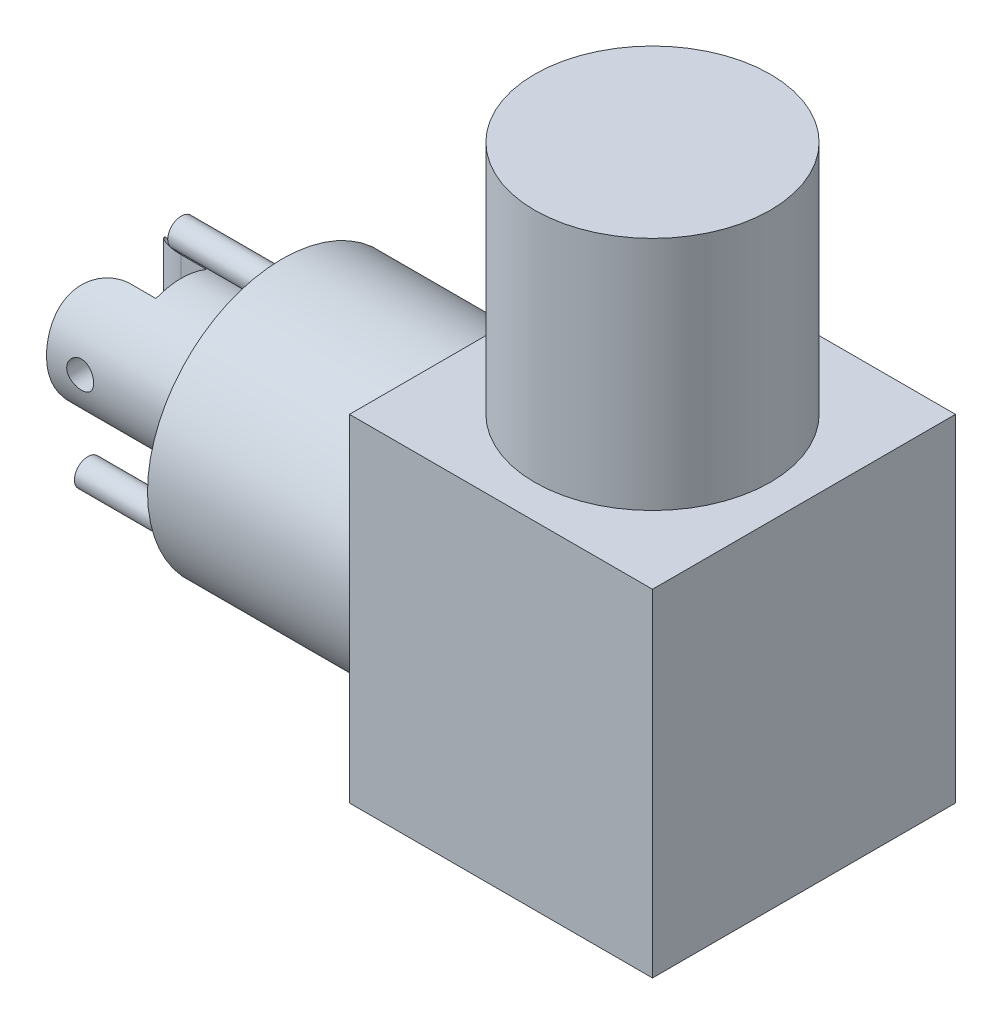
from build123d import *

# Parameters (mm, degrees)
SKETCH2_R               = 20
BOSS_EXTRUDE2_DEPTH     = 50
CUT_EXTRUDE1_DEPTH      = 20
FILLET1_R               = 12.5
CUT_EXTRUDE2_DEPTH      = 61.466933273
CUT_EXTRUDE2_DEPTH_BACK = 61.466933273
SKETCH4_R               = 4
SKETCH5_R               = 40
BOSS_EXTRUDE3_DEPTH     = 65
SKETCH7_R               = 4
BOSS_EXTRUDE5_DEPTH     = 30
CIRPATTERN1_COUNT       = 3
SKETCH8_W               = 90
SKETCH8_H               = 100
BOSS_EXTRUDE6_DEPTH     = 90
SKETCH9_R               = 35
BOSS_EXTRUDE7_DEPTH     = 70


with BuildPart() as part:
    # Sketch2 → Boss-Extrude2 (new body)
    with BuildSketch(Plane(origin=(0, 0, 0), x_dir=(0, 0, -1), z_dir=(1, 0, 0))):
        Circle(SKETCH2_R)
    extrude(amount=BOSS_EXTRUDE2_DEPTH)

    # Sketch3 → Cut-Extrude1 (cut)
    with BuildSketch(Plane.ZY):
        with BuildLine():
            Line((-7.5, 18.540496218), (-7.5, -18.540496218))
            ThreePointArc((-7.5, -18.540496218), (0, -20), (7.5, -18.540496218))
            Line((7.5, -18.540496218), (7.5, 18.540496218))
            ThreePointArc((7.5, 18.540496218), (0, 20), (-7.5, 18.540496218))
        make_face()
    extrude(amount=-CUT_EXTRUDE1_DEPTH, mode=Mode.SUBTRACT)

    # Fillet1
    fillet1_edges = [part.edges().sort_by_distance(p)[0] for p in [
        (0, 0, 7.5),
        (0, 0, -7.5),
    ]]
    fillet(fillet1_edges, radius=FILLET1_R - 0.0001)  # a hair under: the kernel refuses the full size

    # Sketch4 → Cut-Extrude2 (cut, two sides: drawn at the far end of the back side and taken through both)
    with BuildSketch(Plane.XY.offset(-7.5).offset(-CUT_EXTRUDE2_DEPTH_BACK)):
        with Locations((10, 0)):
            Circle(SKETCH4_R)
    extrude(amount=CUT_EXTRUDE2_DEPTH + CUT_EXTRUDE2_DEPTH_BACK, mode=Mode.SUBTRACT)

    # Sketch5 → Boss-Extrude3 (add)
    with BuildSketch(Plane(origin=(50, 0, 0), x_dir=(0, 0, -1), z_dir=(1, 0, 0))):
        Circle(SKETCH5_R)
    extrude(amount=BOSS_EXTRUDE3_DEPTH)

    # Sketch7 → Boss-Extrude5 (add)
    with BuildSketch(Plane.ZY.offset(-50)):
        with Locations(Location((0, 32, 0), (0, 0, 180))):
            Circle(SKETCH7_R)
    boss_extrude5 = extrude(amount=BOSS_EXTRUDE5_DEPTH)

    # CirPattern1: Boss-Extrude5 ×3 about axis
    cirpattern1_axis = Axis((0, 0, 0), (1, 0, 0))
    for i in range(1, CIRPATTERN1_COUNT):
        add(boss_extrude5.rotate(cirpattern1_axis, i * 360 / CIRPATTERN1_COUNT))

    # Sketch8 → Boss-Extrude6 (add)
    with BuildSketch(Plane(origin=(115, 0, 0), x_dir=(0, 0, -1), z_dir=(1, 0, 0))):
        with Locations((0, 5)):
            Rectangle(SKETCH8_W, SKETCH8_H)
    extrude(amount=BOSS_EXTRUDE6_DEPTH)

    # Sketch9 → Boss-Extrude7 (add)
    with BuildSketch(Plane(origin=(0, 55, 0), x_dir=(1, 0, 0), z_dir=(0, 1, 0))):
        with Locations(Location((160, 0, 0), (0, 0, 90))):
            Circle(SKETCH9_R)
    extrude(amount=BOSS_EXTRUDE7_DEPTH)


solid = part.part
